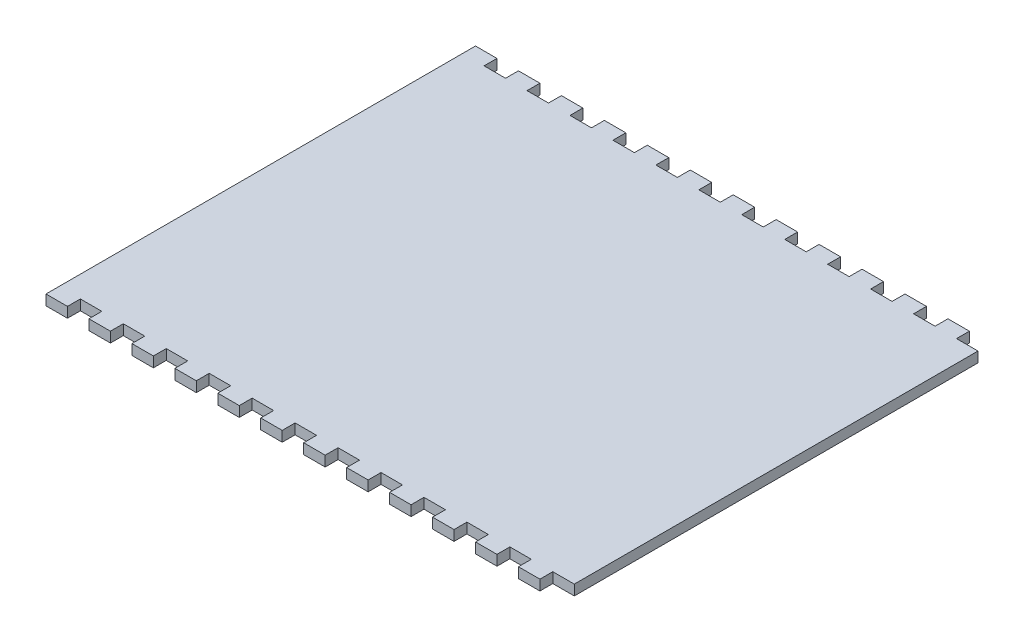
from build123d import *

# Parameters (mm, degrees)
SKETCH1_W           = 152.4
SKETCH1_H           = 127
BOSS_EXTRUDE1_DEPTH = 3.048
SKETCH2_W           = 6.35
SKETCH2_H           = 3.81
CUT_EXTRUDE1_DEPTH  = 100.236990603


with BuildPart() as part:
    # Sketch1 → Boss-Extrude1 (new body)
    with BuildSketch(Plane(origin=(0, 0, 0), x_dir=(1, 0, 0), z_dir=(0, 1, 0))):
        Rectangle(SKETCH1_W, SKETCH1_H)
    extrude(amount=BOSS_EXTRUDE1_DEPTH)

    # Sketch2 → Cut-Extrude1 (cut, through all)
    with BuildSketch(Plane(origin=(0, 3.048, 0), x_dir=(1, 0, 0), z_dir=(0, 1, 0))):
        with Locations((-66.675, 61.595)):
            Rectangle(SKETCH2_W, SKETCH2_H)
        with Locations((-53.975, 61.595)):
            Rectangle(SKETCH2_W, SKETCH2_H)
        with Locations((-41.275, 61.595)):
            Rectangle(SKETCH2_W, SKETCH2_H)
        with Locations((-28.575, 61.595)):
            Rectangle(SKETCH2_W, SKETCH2_H)
        with Locations((-15.875, 61.595)):
            Rectangle(SKETCH2_W, SKETCH2_H)
        with Locations((-3.175, 61.595)):
            Rectangle(SKETCH2_W, SKETCH2_H)
        with Locations((9.525, 61.595)):
            Rectangle(SKETCH2_W, SKETCH2_H)
        with Locations((22.225, 61.595)):
            Rectangle(SKETCH2_W, SKETCH2_H)
        with Locations((34.925, 61.595)):
            Rectangle(SKETCH2_W, SKETCH2_H)
        with Locations((47.625, 61.595)):
            Rectangle(SKETCH2_W, SKETCH2_H)
        with Locations((60.325, 61.595)):
            Rectangle(SKETCH2_W, SKETCH2_H)
        with Locations((73.025, 61.595)):
            Rectangle(SKETCH2_W, SKETCH2_H)
        with Locations((73.025, -61.595)):
            Rectangle(SKETCH2_W, SKETCH2_H)
        with Locations((60.325, -61.595)):
            Rectangle(SKETCH2_W, SKETCH2_H)
        with Locations((47.625, -61.595)):
            Rectangle(SKETCH2_W, SKETCH2_H)
        with Locations((34.925, -61.595)):
            Rectangle(SKETCH2_W, SKETCH2_H)
        with Locations((22.225, -61.595)):
            Rectangle(SKETCH2_W, SKETCH2_H)
        with Locations((9.525, -61.595)):
            Rectangle(SKETCH2_W, SKETCH2_H)
        with Locations((-3.175, -61.595)):
            Rectangle(SKETCH2_W, SKETCH2_H)
        with Locations((-15.875, -61.595)):
            Rectangle(SKETCH2_W, SKETCH2_H)
        with Locations((-28.575, -61.595)):
            Rectangle(SKETCH2_W, SKETCH2_H)
        with Locations((-41.275, -61.595)):
            Rectangle(SKETCH2_W, SKETCH2_H)
        with Locations((-53.975, -61.595)):
            Rectangle(SKETCH2_W, SKETCH2_H)
        with Locations((-66.675, -61.595)):
            Rectangle(SKETCH2_W, SKETCH2_H)
    extrude(amount=-CUT_EXTRUDE1_DEPTH, mode=Mode.SUBTRACT)


solid = part.part
